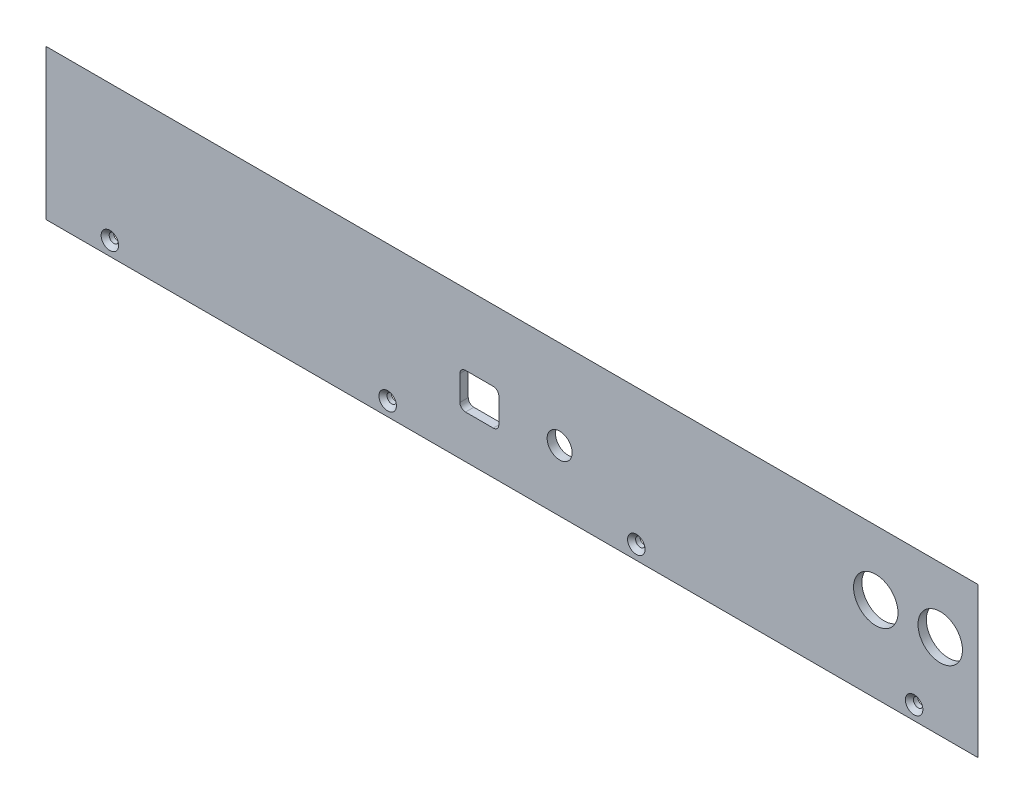
from build123d import *

# Parameters (mm, degrees)
SKETCH1_W                                      = 335.5
SKETCH1_H                                      = 54
BOSS_EXTRUDE1_DEPTH                            = 3
CHAMFER1_SIZE                                  = 3
CSK_FOR_M3_FLAT_HEAD_MACHINE_SCREW1_AT_2_COUNT = 2
CSK_FOR_M3_FLAT_HEAD_MACHINE_SCREW1_AT_2_PITCH = 100
CSK_FOR_M3_FLAT_HEAD_MACHINE_SCREW1_AT_3_COUNT = 2
CSK_FOR_M3_FLAT_HEAD_MACHINE_SCREW1_AT_3_PITCH = 189.5
CSK_FOR_M3_FLAT_HEAD_MACHINE_SCREW1_AT_4_COUNT = 2
CSK_FOR_M3_FLAT_HEAD_MACHINE_SCREW1_AT_4_PITCH = 289.5
SKETCH5_R                                      = 4.5
SKETCH5_R_2                                    = 8
CUT_EXTRUDE1_DEPTH                             = 340.831208102


with BuildPart() as part:
    # Sketch1 → Boss-Extrude1 (new body)
    with BuildSketch(Plane.XY):
        with Locations((167.75, 27)):
            Rectangle(SKETCH1_W, SKETCH1_H)
    extrude(amount=BOSS_EXTRUDE1_DEPTH)

    # Chamfer1
    chamfer1_edges = [part.edges().sort_by_distance(p)[0] for p in [
        (0, 27, 0),
        (167.75, 54, 0),
        (335.5, 27, 0),
    ]]
    chamfer(chamfer1_edges, length=CHAMFER1_SIZE - 0.0001)  # a hair under: the kernel refuses the full size

    # Sketch3 → CSK for M3 Flat Head Machine Screw1 (revolve, cut)
    with BuildSketch(Plane(origin=(23, 5, 3), x_dir=(0, -1, 0), z_dir=(1, 0, 0))):
        Polygon((0, 0), (0, 3), (1.7, 3), (1.7, 1.45), (3.15, 0), align=None)
    csk_for_m3_flat_head_machine_screw1 = revolve(axis=Axis((23, 5, 9.35), (0, 0, -1)), mode=Mode.SUBTRACT)

    # CSK for M3 Flat Head Machine Screw1 at 2: CSK for M3 Flat Head Machine Screw1 ×2
    with Locations(*[(i * CSK_FOR_M3_FLAT_HEAD_MACHINE_SCREW1_AT_2_PITCH, 0, 0) for i in range(1, CSK_FOR_M3_FLAT_HEAD_MACHINE_SCREW1_AT_2_COUNT)]):
        add(csk_for_m3_flat_head_machine_screw1, mode=Mode.SUBTRACT)

    # CSK for M3 Flat Head Machine Screw1 at 3: CSK for M3 Flat Head Machine Screw1 ×2
    with Locations(*[(i * CSK_FOR_M3_FLAT_HEAD_MACHINE_SCREW1_AT_3_PITCH, 0, 0) for i in range(1, CSK_FOR_M3_FLAT_HEAD_MACHINE_SCREW1_AT_3_COUNT)]):
        add(csk_for_m3_flat_head_machine_screw1, mode=Mode.SUBTRACT)

    # CSK for M3 Flat Head Machine Screw1 at 4: CSK for M3 Flat Head Machine Screw1 ×2
    with Locations(*[(i * CSK_FOR_M3_FLAT_HEAD_MACHINE_SCREW1_AT_4_PITCH, 0, 0) for i in range(1, CSK_FOR_M3_FLAT_HEAD_MACHINE_SCREW1_AT_4_COUNT)]):
        add(csk_for_m3_flat_head_machine_screw1, mode=Mode.SUBTRACT)

    # Sketch5 → Cut-Extrude1 (cut, through all)
    with BuildSketch(Plane.XY.offset(3)):
        with Locations((184.9, 22)):
            Circle(SKETCH5_R)
        with Locations((298.7, 30.75)):
            Circle(SKETCH5_R_2)
        with Locations((321.9, 30.75)):
            Circle(SKETCH5_R_2)
        with BuildLine():
            Line((151, 28.5), (161, 28.5))
            ThreePointArc((161, 28.5), (162.414213562, 27.914213562), (163, 26.5))
            Line((163, 26.5), (163, 17.5))
            ThreePointArc((163, 17.5), (162.414213562, 16.085786438), (161, 15.5))
            Line((161, 15.5), (151, 15.5))
            ThreePointArc((151, 15.5), (149.585786438, 16.085786438), (149, 17.5))
            Line((149, 17.5), (149, 26.5))
            ThreePointArc((149, 26.5), (149.585786438, 27.914213562), (151, 28.5))
        make_face()
    extrude(amount=-CUT_EXTRUDE1_DEPTH, mode=Mode.SUBTRACT)


solid = part.part
